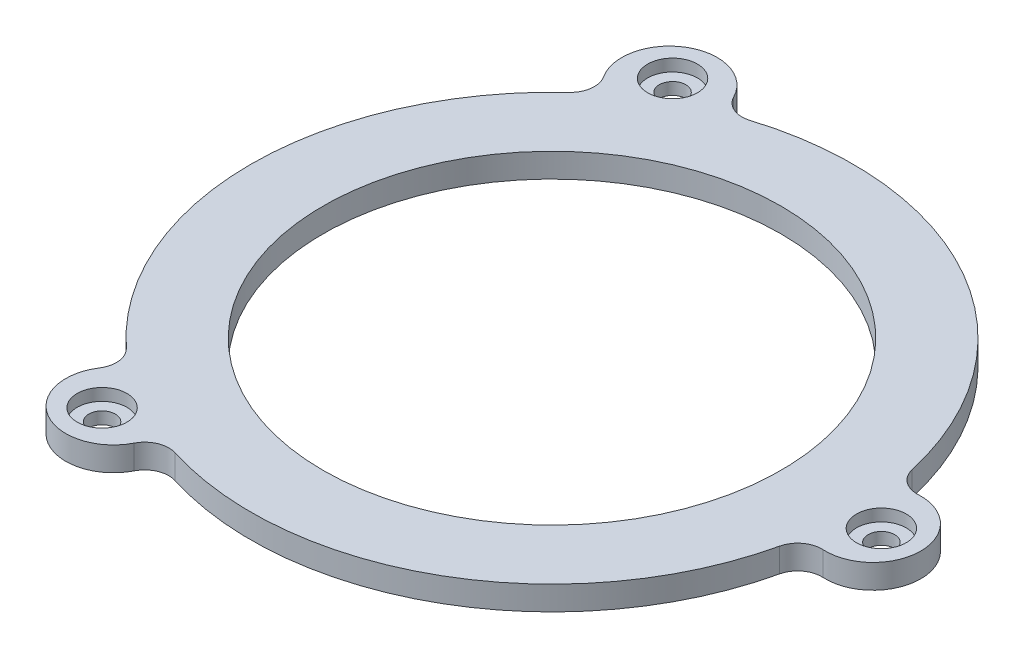
from build123d import *

# Parameters (mm, degrees)
SKETCH1_R           = 37.5
SKETCH1_R_2         = 28.5
BOSS_EXTRUDE1_DEPTH = 3
BOSS_EXTRUDE2_START = -3
BOSS_EXTRUDE2_DEPTH = 3
SKETCH6_R           = 1.65
CUT_EXTRUDE2_DEPTH  = 10
SKETCH7_R           = 3.1
CUT_EXTRUDE3_DEPTH  = 1.5
FILLET1_R           = 3


with BuildPart() as part:
    # Sketch1 → Boss-Extrude1 (new body)
    with BuildSketch(Plane(origin=(0, 0, 0), x_dir=(1, 0, 0), z_dir=(0, 1, 0))):
        Circle(SKETCH1_R)
        Circle(SKETCH1_R_2, mode=Mode.SUBTRACT)
    extrude(amount=BOSS_EXTRUDE1_DEPTH)

    # Sketch3 → Boss-Extrude2 (add)
    with BuildSketch(Plane(origin=(0, 3, 0), x_dir=(1, 0, 0), z_dir=(0, 1, 0)).offset(BOSS_EXTRUDE2_START)):
        with BuildLine():
            ThreePointArc((37.135052578, 5.218991286), (45.901049183, 0), (37.135052578, -5.218991286))
            ThreePointArc((37.135052578, -5.218991286), (37.5, 0), (37.135052578, 5.218991286))
        make_face()
        with BuildLine():
            ThreePointArc((-14.047747253, -34.769394546), (-22.950524592, -39.751474653), (-23.087305325, -29.55040326))
            ThreePointArc((-23.087305325, -29.55040326), (-18.75, -32.475952642), (-14.047747253, -34.769394546))
        make_face()
        with BuildLine():
            ThreePointArc((-23.087305325, 29.55040326), (-22.950524592, 39.751474653), (-14.047747253, 34.769394546))
            ThreePointArc((-14.047747253, 34.769394546), (-18.75, 32.475952642), (-23.087305325, 29.55040326))
        make_face()
    extrude(amount=BOSS_EXTRUDE2_DEPTH)

    # Sketch6 → Cut-Extrude2 (cut)
    with BuildSketch(Plane(origin=(0, 3, 0), x_dir=(1, 0, 0), z_dir=(0, 1, 0))):
        with Locations((41, 0)):
            Circle(SKETCH6_R)
        with Locations((-20.5, -35.507041555)):
            Circle(SKETCH6_R)
        with Locations((-20.5, 35.507041555)):
            Circle(SKETCH6_R)
    extrude(amount=-CUT_EXTRUDE2_DEPTH, mode=Mode.SUBTRACT)

    # Sketch7 → Cut-Extrude3 (cut)
    with BuildSketch(Plane(origin=(0, 3, 0), x_dir=(1, 0, 0), z_dir=(0, 1, 0))):
        with Locations((41, 0)):
            Circle(SKETCH7_R)
        with Locations((-20.5, -35.507041555)):
            Circle(SKETCH7_R)
        with Locations((-20.5, 35.507041555)):
            Circle(SKETCH7_R)
    extrude(amount=-CUT_EXTRUDE3_DEPTH, mode=Mode.SUBTRACT)

    # Fillet1
    fillet1_edges = [part.edges().sort_by_distance(p)[0] for p in [
        (37.135052578, 1.5, 5.218991286),
        (-14.047747253, 1.5, 34.769394546),
        (-23.087305325, 1.5, 29.55040326),
        (-23.087305325, 1.5, -29.55040326),
        (-14.047747253, 1.5, -34.769394546),
        (37.135052578, 1.5, -5.218991286),
    ]]
    fillet(fillet1_edges, radius=FILLET1_R)


solid = part.part
